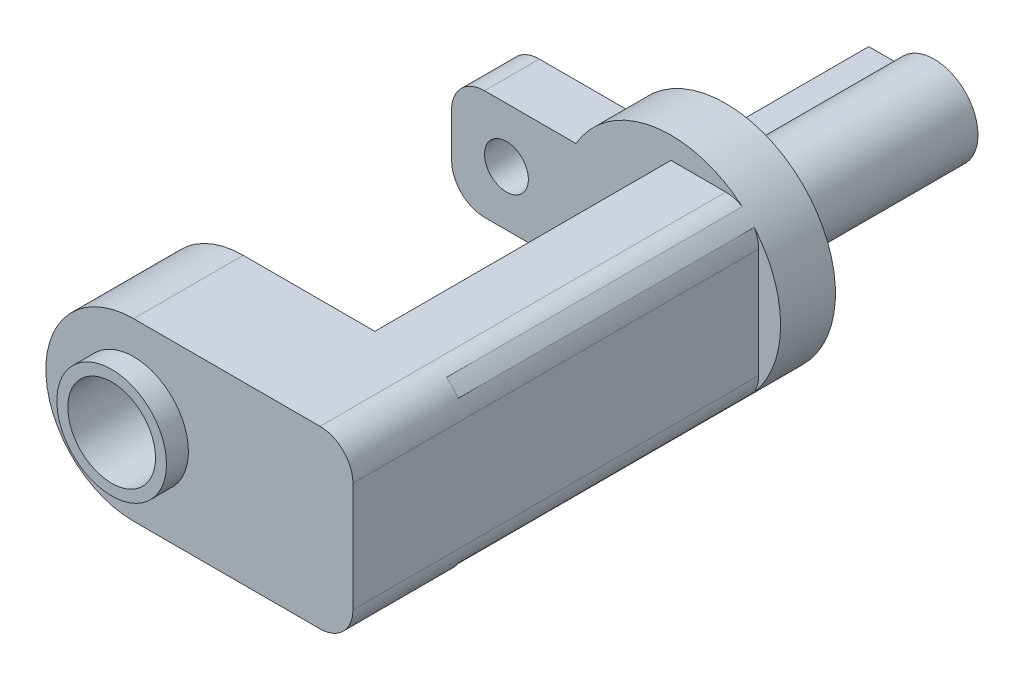
from build123d import *

# Parameters (mm, degrees)
RESSALTO_EXTRUS_O2_DEPTH  = 19
ESBO_O2_R                 = 2
RESSALTO_EXTRUS_O3_DEPTH  = 5
FILETE1_R                 = 3
ESBO_O3_R                 = 4
RESSALTO_EXTRUS_O4_DEPTH  = 17
RESSALTO_EXTRUS_O6_START  = 10
ESBO_O4_R                 = 4
RESSALTO_EXTRUS_O6_DEPTH  = 10
ESBO_O5_R                 = 4
RESSALTO_EXTRUS_O7_DEPTH  = 10
RESSALTO_EXTRUS_O10_DEPTH = 27
FILETE2_R                 = 10
ESBO_O8_R                 = 5
ESBO_O8_R_2               = 4
RESSALTO_EXTRUS_O11_DEPTH = 2


with BuildPart() as part:
    # Esboço1 → Ressalto-extrusão2 (new body)
    with BuildSketch(Plane.XY):
        with BuildLine():
            Line((-5.964101615, -2), (-3.464101615, -2))
            ThreePointArc((-3.464101615, -2), (4, 0), (-3.464101615, 2))
            Line((-3.464101615, 2), (-5.964101615, 2))
            Line((-5.964101615, 2), (-5.964101615, -2))
        make_face()
    extrude(amount=RESSALTO_EXTRUS_O2_DEPTH)

    # Esboço2 → Ressalto-extrusão3 (add)
    with BuildSketch(Plane.XY.offset(19)):
        with BuildLine():
            Line((-20, -5), (-8.660254038, -5))
            ThreePointArc((-8.660254038, -5), (10, 0), (-8.660254038, 5))
            Line((-8.660254038, 5), (-20, 5))
            Line((-20, 5), (-20, -5))
        make_face()
        with Locations((-15, 0)):
            Circle(ESBO_O2_R, mode=Mode.SUBTRACT)
    extrude(amount=RESSALTO_EXTRUS_O3_DEPTH)

    # Filete1
    filete1_edges = [part.edges().sort_by_distance(p)[0] for p in [
        (-20, 5, 21.5),
        (-20, -5, 21.5),
    ]]
    fillet(filete1_edges, radius=FILETE1_R)

    # Esboço3 → Ressalto-extrusão4 (add)
    with BuildSketch(Plane.XY.offset(24)):
        Circle(ESBO_O3_R)
    extrude(amount=RESSALTO_EXTRUS_O4_DEPTH)

    # Esboço5 → Ressalto-extrusão7 (add)
    with BuildSketch(Plane.XY.offset(41)):
        Circle(ESBO_O5_R)
    extrude(amount=RESSALTO_EXTRUS_O7_DEPTH)



with BuildPart() as body_2:
    # Esboço4 → Ressalto-extrusão6 (new body)
    with BuildSketch(Plane.XY.offset(41).offset(RESSALTO_EXTRUS_O6_START)):
        with BuildLine():
            Line((4, -8), (5, -8))
            ThreePointArc((5, -8), (7.121320344, -7.121320344), (8, -5))
            Line((8, -5), (8, 5))
            ThreePointArc((8, 5), (7.121320344, 7.121320344), (5, 8))
            Line((5, 8), (4, 8))
            Line((4, 8), (-4, 8))
            Line((-4, 8), (-12, 8))
            ThreePointArc((-12, 8), (-20, 0), (-12, -8))
            Line((-12, -8), (-4, -8))
            Line((-4, -8), (4, -8))
        make_face()
        with Locations((-12, 0)):
            Circle(ESBO_O4_R, mode=Mode.SUBTRACT)
    extrude(amount=RESSALTO_EXTRUS_O6_DEPTH)


with BuildPart() as part_1:
    add(part.part)

    add(body_2.part)  # Ressalto-extrusão10 merges body 2
    # Esboço7 → Ressalto-extrusão10 (add)
    with BuildSketch(Plane.XY.offset(24)):
        with BuildLine():
            Line((0, 8), (0, 4))
            ThreePointArc((0, 4), (2.828427125, 2.828427125), (4, 0))
            ThreePointArc((4, 0), (2.828427125, -2.828427125), (0, -4))
            Line((0, -4), (0, -8))
            Line((0, -8), (5, -8))
            ThreePointArc((5, -8), (5.779003589, -7.897093959), (6.504564394, -7.595435606))
            ThreePointArc((6.504564394, -7.595435606), (7.071067812, -7.071067812), (7.595435606, -6.504564394))
            ThreePointArc((7.595435606, -6.504564394), (7.897093959, -5.779003589), (8, -5))
            Line((8, -5), (8, 5))
            ThreePointArc((8, 5), (7.897093959, 5.779003589), (7.595435606, 6.504564394))
            ThreePointArc((7.595435606, 6.504564394), (7.071067812, 7.071067812), (6.504564394, 7.595435606))
            ThreePointArc((6.504564394, 7.595435606), (5.779003589, 7.897093959), (5, 8))
            Line((5, 8), (0, 8))
        make_face()
    extrude(amount=RESSALTO_EXTRUS_O10_DEPTH)

    # Filete2
    # the kernel refuses this fillet: 10 mm, written as the material it adds along each edge
    with BuildSketch(Plane(origin=(0, -4, 14), x_dir=(0, -1, 0), z_dir=(0, 0, 1))) as filete2_piece_1_section:
        with BuildLine():
            CenterArc((6, -9.797958971), FILETE2_R, 101.536959033, 34.04773237)
            ThreePointArc((-1.142857143, -2.799416849), (-0.296719601, -1.511857892), (0, 0))
            Line((0, 0), (4, 0))
        make_face()
    filete2_piece_1 = extrude(amount=47, mode=Mode.PRIVATE)
    filete2_piece_1 = split(filete2_piece_1, bisect_by=Plane(origin=(-0.997292113, -5.209523734, 19), z_dir=(0, 0, 1)), keep=Keep.TOP, mode=Mode.PRIVATE)
    add(filete2_piece_1)
    with BuildSketch(Plane(origin=(0, 4, 14), x_dir=(-0.9258200997725515, -0.3779644730092269, 0), z_dir=(0, 0, 1))) as filete2_piece_2_section:
        with BuildLine():
            CenterArc((6.803360514, -9.258200998), FILETE2_R, 112.207654299, 34.04773237)
            Line((-1.511857892, -3.703280399), (0, 0))
            ThreePointArc((0, 0), (1.511857892, -0.296719601), (3.023715784, 0))
        make_face()
    filete2_piece_2 = extrude(amount=47, mode=Mode.PRIVATE)
    filete2_piece_2 = split(filete2_piece_2, bisect_by=Plane(origin=(-0.997292113, 5.209523734, 19), z_dir=(0, 0, 1)), keep=Keep.TOP, mode=Mode.PRIVATE)
    add(filete2_piece_2)

    # Esboço8 → Ressalto-extrusão11 (add)
    with BuildSketch(Plane.XY.offset(61)):
        with Locations((-12, 0)):
            Circle(ESBO_O8_R)
        with Locations((-12, 0)):
            Circle(ESBO_O8_R_2, mode=Mode.SUBTRACT)
    extrude(amount=RESSALTO_EXTRUS_O11_DEPTH)


solid = part_1.part
